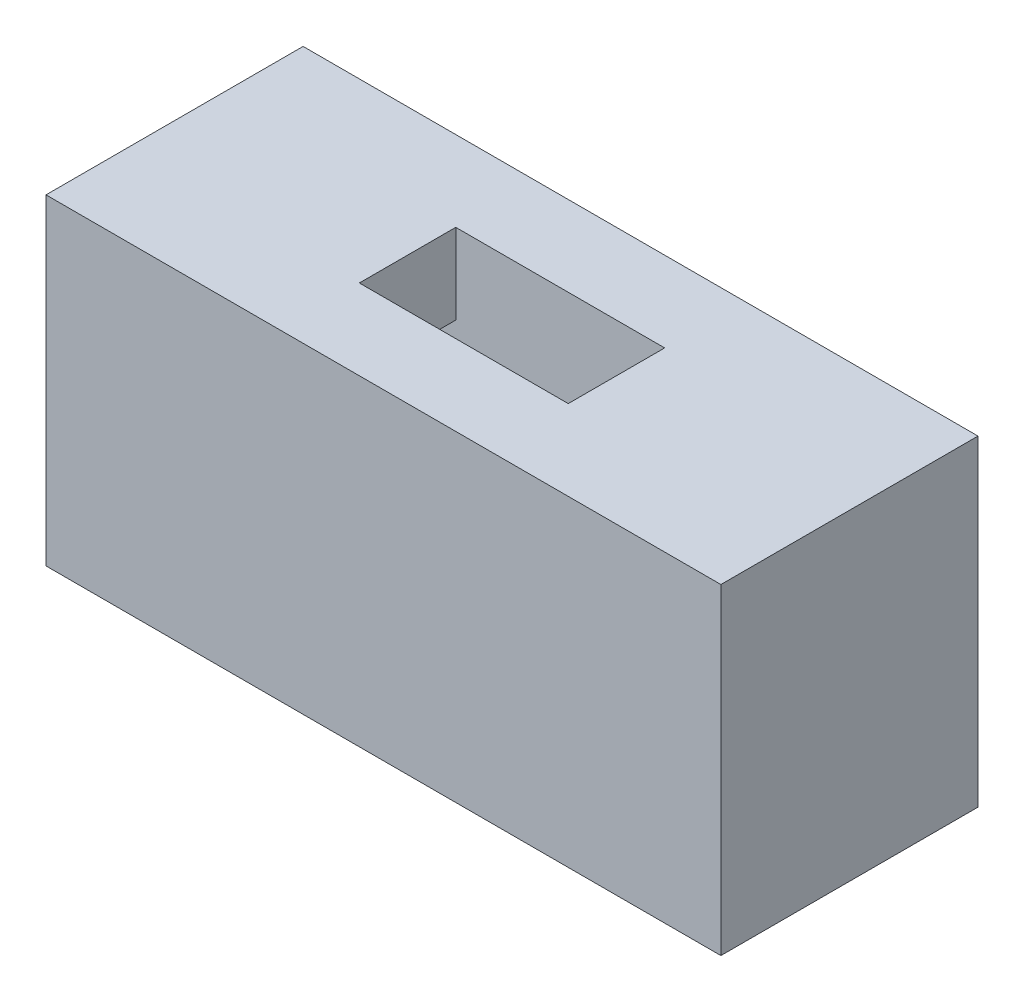
from build123d import *

# Parameters (mm, degrees)
ESQUISSE1_W             = 42
ESQUISSE1_H             = 16
BOSS_EXTRU_1_DEPTH      = 20
ESQUISSE2_W             = 13
ESQUISSE2_H             = 6
ENL_V_MAT_EXTRU_1_DEPTH = 10
ESQUISSE3_W             = 6
ESQUISSE3_H             = 5
ENL_V_MAT_EXTRU_2_DEPTH = 35.932076949


with BuildPart() as part:
    # Esquisse1 → Boss.-Extru.1 (new body)
    with BuildSketch(Plane(origin=(0, 0, 0), x_dir=(1, 0, 0), z_dir=(0, 1, 0))):
        Rectangle(ESQUISSE1_W, ESQUISSE1_H)
    extrude(amount=BOSS_EXTRU_1_DEPTH)

    # Esquisse2 → Enlèv. mat.-Extru.1 (cut)
    with BuildSketch(Plane(origin=(0, 20, 0), x_dir=(1, 0, 0), z_dir=(0, 1, 0))):
        Rectangle(ESQUISSE2_W, ESQUISSE2_H)
    extrude(amount=-ENL_V_MAT_EXTRU_1_DEPTH, mode=Mode.SUBTRACT)

    # Esquisse3 → Enlèv. mat.-Extru.2 (cut, through all)
    with BuildSketch(Plane(origin=(-6.5, 0, 0), x_dir=(0, 0, -1), z_dir=(1, 0, 0))):
        with Locations((0, 12.5)):
            Rectangle(ESQUISSE3_W, ESQUISSE3_H)
    extrude(amount=-ENL_V_MAT_EXTRU_2_DEPTH, mode=Mode.SUBTRACT)


solid = part.part
